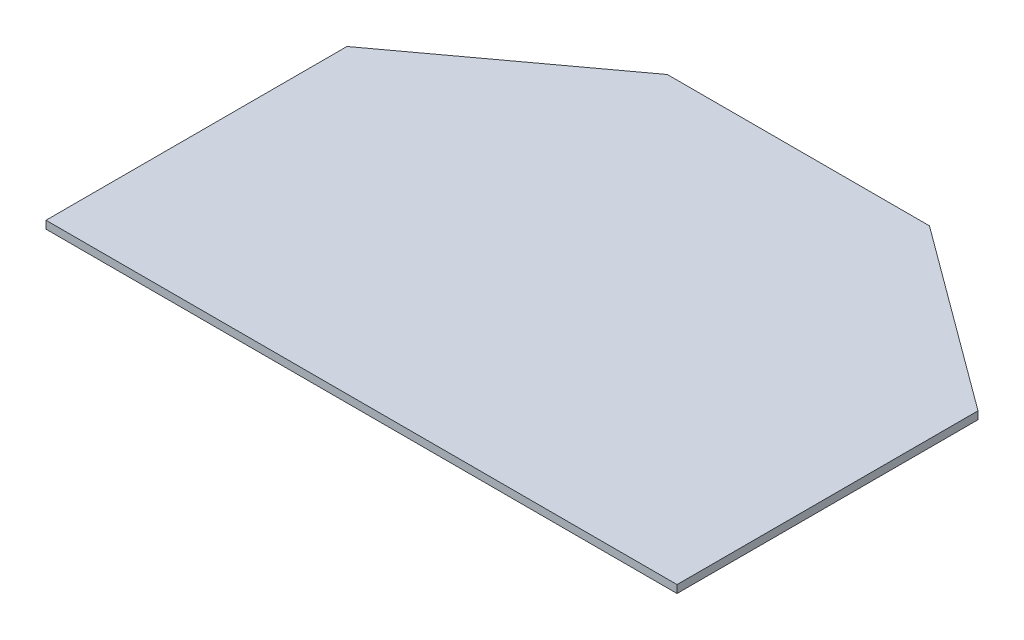
from build123d import *

# Parameters (mm, degrees)
BOSS_EXTRUDE1_DEPTH = 1.6


with BuildPart() as part:
    # Sketch1 → Boss-Extrude1 (new body)
    with BuildSketch(Plane(origin=(0, 0, 0), x_dir=(1, 0, 0), z_dir=(0, 1, 0))):
        Polygon((-65, 52), (-27, 80), (0, 80), (0, -10), (-65, -10), align=None)
    boss_extrude1 = extrude(amount=BOSS_EXTRUDE1_DEPTH)

    # Mirror1: Boss-Extrude1 across plane
    add(boss_extrude1.mirror(Plane(origin=(0, 1.6, 10), x_dir=(0, 0, 1), z_dir=(-1, 0, 0))))


solid = part.part
